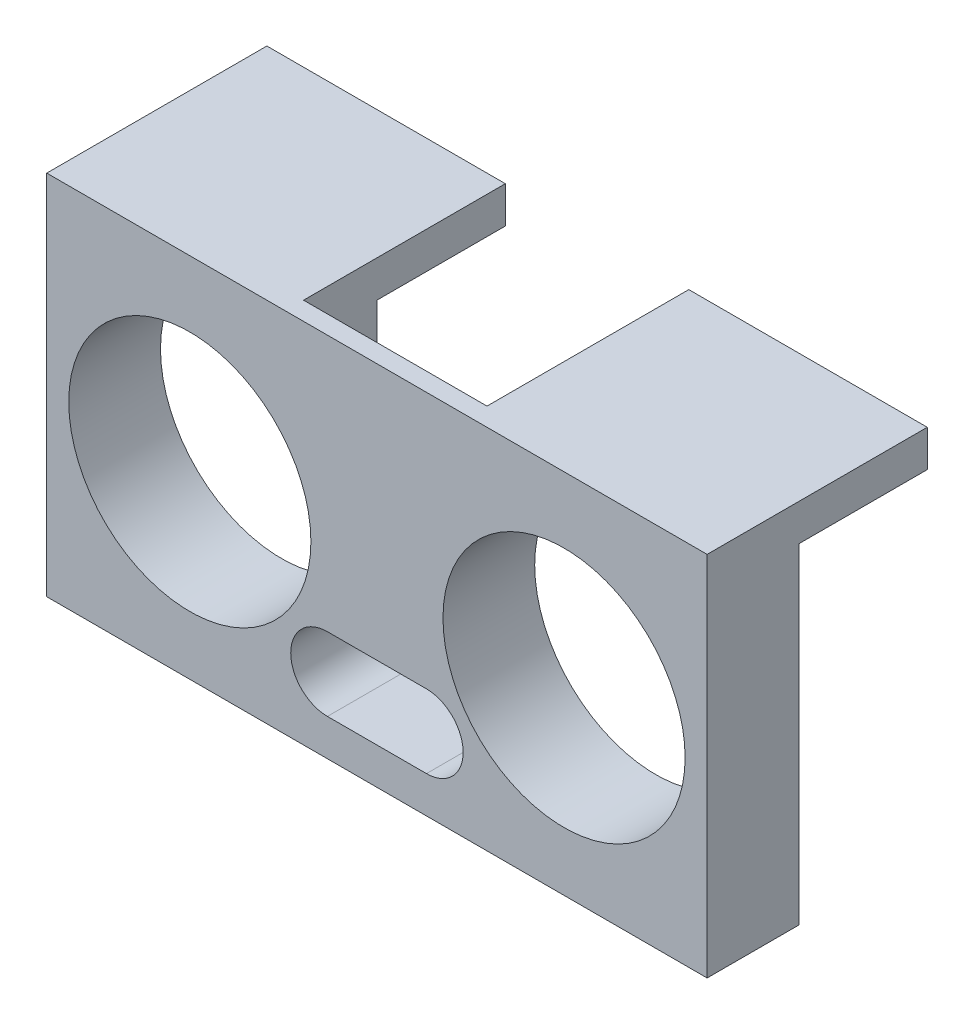
from build123d import *

# Parameters (mm, degrees)
SKETCH1_W           = 45.72
SKETCH1_H           = 22.86
SKETCH1_R           = 8.382
BOSS_EXTRUDE1_DEPTH = 6.35
SKETCH2_W           = 12.7
SKETCH2_H           = 3.81
CUT_EXTRUDE1_DEPTH  = 5.08
BOSS_EXTRUDE2_DEPTH = 2.54


with BuildPart() as part:
    # Sketch1 → Boss-Extrude1 (new body)
    with BuildSketch(Plane.XY):
        with Locations((22.86, 11.43)):
            Rectangle(SKETCH1_W, SKETCH1_H)
        with Locations((9.906, 12.446)):
            Circle(SKETCH1_R, mode=Mode.SUBTRACT)
        with Locations((35.814, 12.446)):
            Circle(SKETCH1_R, mode=Mode.SUBTRACT)
        with BuildLine():
            Line((19.431, 7.62), (26.289, 7.62))
            ThreePointArc((26.289, 7.62), (28.829, 5.08), (26.289, 2.54))
            Line((26.289, 2.54), (19.431, 2.54))
            ThreePointArc((19.431, 2.54), (16.891, 5.08), (19.431, 7.62))
        make_face(mode=Mode.SUBTRACT)
    extrude(amount=BOSS_EXTRUDE1_DEPTH)

    # Sketch2 → Cut-Extrude1 (cut)
    with BuildSketch(Plane(origin=(0, 0, 0), x_dir=(-1, 0, 0), z_dir=(0, 0, -1))):
        with Locations((-22.86, 20.955)):
            Rectangle(SKETCH2_W, SKETCH2_H)
    extrude(amount=-CUT_EXTRUDE1_DEPTH, mode=Mode.SUBTRACT)

    # Sketch3 → Boss-Extrude2 (add)
    with BuildSketch(Plane(origin=(0, 22.86, 0), x_dir=(1, 0, 0), z_dir=(0, 1, 0))):
        Polygon((0, -6.35), (0, 8.89), (16.51, 8.89), (16.51, -5.08), (29.21, -5.08), (29.21, 8.89), (45.72, 8.89), (45.72, -6.35), align=None)
    extrude(amount=BOSS_EXTRUDE2_DEPTH)


solid = part.part
